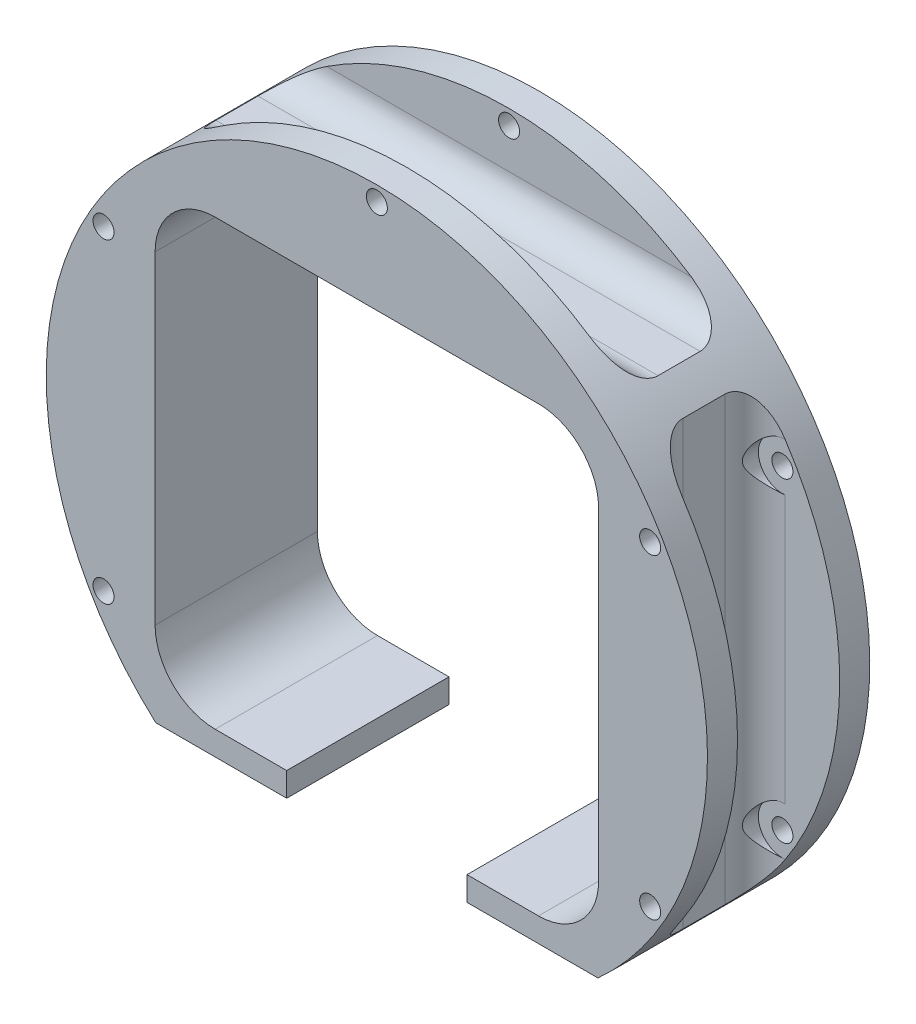
from build123d import *
from build123d.topology import SkipClean

# Parameters (mm, degrees)
SKETCH_2_W               = 77.78174593
SKETCH_2_H               = 77.78174593
SKETCH_2_W_2             = 73.78174593
SKETCH_2_H_2             = 73.78174593
EXTRUDE_1_DEPTH          = 22
SKETCH_3_W               = 30
SKETCH_3_H               = 11.217172917
CUT_EXTRUDE_1_DEPTH      = 25
FILLET_2_R               = 10
EXTRUDE_2_DEPTH          = 5
CUT_EXTRUDE_2_DEPTH      = 120.845734175
CUT_EXTRUDE_2_DEPTH_BACK = 120.845734175
SKETCH_5_R               = 1.5
FILLET_START             = 11.21771439
FILLET_3_DEPTH           = 73.564570859
FILLET_START_2           = -36.78228561
FILLET_3_2_DEPTH         = 73.564570859
FILLET_START_3           = -1e-07
FILLET_3_3_DEPTH         = 22.0000001
EXTRUDE_3_DEPTH          = 5
CUT_EXTRUDE_START        = -5
SKETCH_7_R               = 1.5
CUT_EXTRUDE_3_DEPTH      = 5
FILLET_4_R               = 5
CUT_EXTRUDE_4_DEPTH      = 8.5
CUT_EXTRUDE_4_DEPTH_BACK = 8.5
SKETCH_8_R               = 4
SKETCH_9_R               = 1.75
SKETCH_9_R_2             = 1.5
CUT_EXTRUDE_5_DEPTH      = 120.84573433


with BuildPart() as part:
    # 草图2 → 凸台-拉伸1 (new body)
    # profile 1 of 5: a face of its own
    with BuildSketch(Plane.XY):
        with Locations((0, 48)):
            Rectangle(SKETCH_2_W, SKETCH_2_H)
        with Locations((0, 48)):
            Rectangle(SKETCH_2_W_2, SKETCH_2_H_2, mode=Mode.SUBTRACT)
    # profile 2 of 5: a face of its own
    with BuildSketch(Plane.XY):
        with BuildLine():
            Line((-38.890872965, 9.109127035), (-38.890872965, 86.890872965))
            ThreePointArc((-38.890872965, 86.890872965), (-39.904802737, 85.849791526), (-40.890872965, 84.782285249))
            Line((-40.890872965, 84.782285249), (-40.890872965, 11.217714751))
            ThreePointArc((-40.890872965, 11.217714751), (-39.904802737, 10.150208474), (-38.890872965, 9.109127035))
        make_face()
    # profile 3 of 5: a face of its own
    with BuildSketch(Plane.XY):
        with BuildLine():
            ThreePointArc((-36.782285249, 88.890872965), (-37.849791526, 87.904802737), (-38.890872965, 86.890872965))
            Line((-38.890872965, 86.890872965), (38.890872965, 86.890872965))
            ThreePointArc((38.890872965, 86.890872965), (37.849791526, 87.904802737), (36.782285249, 88.890872965))
            Line((36.782285249, 88.890872965), (-36.782285249, 88.890872965))
        make_face()
    # profile 4 of 5: a face of its own
    with BuildSketch(Plane.XY):
        with BuildLine():
            ThreePointArc((40.890872965, 84.782285249), (39.904802737, 85.849791526), (38.890872965, 86.890872965))
            Line((38.890872965, 86.890872965), (38.890872965, 9.109127035))
            ThreePointArc((38.890872965, 9.109127035), (39.904802737, 10.150208474), (40.890872965, 11.217714751))
            Line((40.890872965, 11.217714751), (40.890872965, 84.782285249))
        make_face()
    # profile 5 of 5: a face of its own
    with BuildSketch(Plane.XY):
        with BuildLine():
            Line((38.890872965, 9.109127035), (-38.890872965, 9.109127035))
            ThreePointArc((-38.890872965, 9.109127035), (-37.849791526, 8.095197263), (-36.782285249, 7.109127035))
            Line((-36.782285249, 7.109127035), (36.782285249, 7.109127035))
            ThreePointArc((36.782285249, 7.109127035), (37.849791526, 8.095197263), (38.890872965, 9.109127035))
        make_face()
    extrude(amount=EXTRUDE_1_DEPTH)

    # 草图3 → 切除-拉伸1 (cut)
    with BuildSketch(Plane.XY.offset(22)):
        with Locations((0, 7.109127035)):
            Rectangle(SKETCH_3_W, SKETCH_3_H)
    extrude(amount=-CUT_EXTRUDE_1_DEPTH, mode=Mode.SUBTRACT)

    # 圆角2
    fillet_2_edges = [part.edges().sort_by_distance(p)[0] for p in [
        (-36.890872965, 11.109127035, 11),
        (36.890872965, 11.109127035, 11),
        (36.890872965, 84.890872965, 11),
        (-36.890872965, 84.890872965, 11),
    ]]
    fillet(fillet_2_edges, radius=FILLET_2_R)

    # 草图4 → 凸台-拉伸2 (add)
    with BuildSketch(Plane.XY.offset(22)):
        with BuildLine():
            Line((32.926987535, 88.890872965), (36.782285249, 88.890872965))
            ThreePointArc((36.782285249, 88.890872965), (0, 103), (-36.782285249, 88.890872965))
            Line((-36.782285249, 88.890872965), (-32.926987535, 88.890872965))
            ThreePointArc((-32.926987535, 88.890872965), (-18.162335251, 97.258294512), (-1.499846931, 100.478571429))
            ThreePointArc((-1.499846931, 100.478571429), (-0.010714559, 101.999961732), (1.5, 100.5))
            ThreePointArc((1.5, 100.5), (1.499961732, 100.489285441), (1.499846931, 100.478571429))
            ThreePointArc((1.499846931, 100.478571429), (18.162335251, 97.258294512), (32.926987535, 88.890872965))
        make_face()
        with BuildLine():
            Line((28.773885871, 88.890872965), (32.926987535, 88.890872965))
            ThreePointArc((32.926987535, 88.890872965), (18.162335251, 97.258294512), (1.499846931, 100.478571429))
            ThreePointArc((1.499846931, 100.478571429), (0, 99), (-1.499846931, 100.478571429))
            ThreePointArc((-1.499846931, 100.478571429), (-18.162335251, 97.258294512), (-32.926987535, 88.890872965))
            Line((-32.926987535, 88.890872965), (-28.773885871, 88.890872965))
            ThreePointArc((-28.773885871, 88.890872965), (0, 98), (28.773885871, 88.890872965))
        make_face()
        with BuildLine():
            Line((40.890872965, 80.926987535), (40.890872965, 84.782285249))
            ThreePointArc((40.890872965, 84.782285249), (38.890872965, 86.890872965), (36.782285249, 88.890872965))
            Line((36.782285249, 88.890872965), (32.926987535, 88.890872965))
            ThreePointArc((32.926987535, 88.890872965), (37.123106012, 85.123106012), (40.890872965, 80.926987535))
        make_face()
        with BuildLine():
            Line((40.890872965, 76.773885871), (40.890872965, 80.926987535))
            ThreePointArc((40.890872965, 80.926987535), (37.123106012, 85.123106012), (32.926987535, 88.890872965))
            Line((32.926987535, 88.890872965), (28.773885871, 88.890872965))
            ThreePointArc((28.773885871, 88.890872965), (35.355339059, 83.355339059), (40.890872965, 76.773885871))
        make_face()
        with BuildLine():
            ThreePointArc((40.890872965, 11.217714751), (51.351718633, 28.302259179), (55, 48))
            ThreePointArc((55, 48), (51.351718633, 67.697740821), (40.890872965, 84.782285249))
            Line((40.890872965, 84.782285249), (40.890872965, 80.926987535))
            ThreePointArc((40.890872965, 80.926987535), (42.879100562, 78.292453433), (44.697852546, 75.538191258))
            ThreePointArc((44.697852546, 75.538191258), (46.207035484, 75.554362244), (46.966333699, 74.25))
            ThreePointArc((46.966333699, 74.25), (46.759981384, 73.490740054), (46.197699477, 72.94038017))
            ThreePointArc((46.197699477, 72.94038017), (50.900045297, 60.862168897), (52.5, 48))
            ThreePointArc((52.5, 48), (50.900045297, 35.137831103), (46.197699477, 23.05961983))
            ThreePointArc((46.197699477, 23.05961983), (46.759981384, 22.509259946), (46.966333699, 21.75))
            ThreePointArc((46.966333699, 21.75), (46.207035484, 20.445637756), (44.697852546, 20.461808742))
            ThreePointArc((44.697852546, 20.461808742), (42.879100562, 17.707546567), (40.890872965, 15.073012465))
            Line((40.890872965, 15.073012465), (40.890872965, 11.217714751))
        make_face()
        with BuildLine():
            ThreePointArc((44.697852546, 75.538191258), (42.879100562, 78.292453433), (40.890872965, 80.926987535))
            Line((40.890872965, 80.926987535), (40.890872965, 76.773885871))
            ThreePointArc((40.890872965, 76.773885871), (47.668352438, 63.09066519), (50, 48))
            ThreePointArc((50, 48), (47.668352438, 32.90933481), (40.890872965, 19.226114129))
            Line((40.890872965, 19.226114129), (40.890872965, 15.073012465))
            ThreePointArc((40.890872965, 15.073012465), (42.879100562, 17.707546567), (44.697852546, 20.461808742))
            ThreePointArc((44.697852546, 20.461808742), (44.167295593, 22.5), (46.197699477, 23.05961983))
            ThreePointArc((46.197699477, 23.05961983), (50.900045297, 35.137831103), (52.5, 48))
            ThreePointArc((52.5, 48), (50.900045297, 60.862168897), (46.197699477, 72.94038017))
            ThreePointArc((46.197699477, 72.94038017), (44.167295593, 73.5), (44.697852546, 75.538191258))
        make_face()
        with BuildLine():
            ThreePointArc((36.782285249, 7.109127035), (38.890872965, 9.109127035), (40.890872965, 11.217714751))
            Line((40.890872965, 11.217714751), (40.890872965, 15.073012465))
            ThreePointArc((40.890872965, 15.073012465), (37.123106012, 10.876893988), (32.926987535, 7.109127035))
            Line((32.926987535, 7.109127035), (36.782285249, 7.109127035))
        make_face()
        with BuildLine():
            ThreePointArc((-36.782285249, 7.109127035), (0, -7), (36.782285249, 7.109127035))
            Line((36.782285249, 7.109127035), (32.926987535, 7.109127035))
            ThreePointArc((32.926987535, 7.109127035), (18.162335251, -1.258294512), (1.499846931, -4.478571429))
            ThreePointArc((1.499846931, -4.478571429), (1.499961732, -4.489285441), (1.5, -4.5))
            ThreePointArc((1.5, -4.5), (-0.010714559, -5.999961732), (-1.499846931, -4.478571429))
            ThreePointArc((-1.499846931, -4.478571429), (-18.162335251, -1.258294512), (-32.926987535, 7.109127035))
            Line((-32.926987535, 7.109127035), (-36.782285249, 7.109127035))
        make_face()
        with BuildLine():
            ThreePointArc((1.499846931, -4.478571429), (18.162335251, -1.258294512), (32.926987535, 7.109127035))
            Line((32.926987535, 7.109127035), (28.773885871, 7.109127035))
            ThreePointArc((28.773885871, 7.109127035), (0, -2), (-28.773885871, 7.109127035))
            Line((-28.773885871, 7.109127035), (-32.926987535, 7.109127035))
            ThreePointArc((-32.926987535, 7.109127035), (-18.162335251, -1.258294512), (-1.499846931, -4.478571429))
            ThreePointArc((-1.499846931, -4.478571429), (0, -3), (1.499846931, -4.478571429))
        make_face()
        with BuildLine():
            ThreePointArc((32.926987535, 7.109127035), (37.123106012, 10.876893988), (40.890872965, 15.073012465))
            Line((40.890872965, 15.073012465), (40.890872965, 19.226114129))
            ThreePointArc((40.890872965, 19.226114129), (35.355339059, 12.644660941), (28.773885871, 7.109127035))
            Line((28.773885871, 7.109127035), (32.926987535, 7.109127035))
        make_face()
        with BuildLine():
            ThreePointArc((-40.890872965, 15.073012465), (-37.123106012, 10.876893988), (-32.926987535, 7.109127035))
            Line((-32.926987535, 7.109127035), (-28.773885871, 7.109127035))
            ThreePointArc((-28.773885871, 7.109127035), (-35.355339059, 12.644660941), (-40.890872965, 19.226114129))
            Line((-40.890872965, 19.226114129), (-40.890872965, 15.073012465))
        make_face()
        with BuildLine():
            ThreePointArc((-40.890872965, 11.217714751), (-38.890872965, 9.109127035), (-36.782285249, 7.109127035))
            Line((-36.782285249, 7.109127035), (-32.926987535, 7.109127035))
            ThreePointArc((-32.926987535, 7.109127035), (-37.123106012, 10.876893988), (-40.890872965, 15.073012465))
            Line((-40.890872965, 15.073012465), (-40.890872965, 11.217714751))
        make_face()
        with BuildLine():
            Line((-40.890872965, 76.773885871), (-40.890872965, 80.926987535))
            ThreePointArc((-40.890872965, 80.926987535), (-42.879100562, 78.292453433), (-44.697852546, 75.538191258))
            ThreePointArc((-44.697852546, 75.538191258), (-44.161971454, 74.990701786), (-43.966333699, 74.25))
            ThreePointArc((-43.966333699, 74.25), (-44.707073752, 72.956352315), (-46.197699477, 72.94038017))
            ThreePointArc((-46.197699477, 72.94038017), (-52.5, 48), (-46.197699477, 23.05961983))
            ThreePointArc((-46.197699477, 23.05961983), (-44.707073752, 23.043647685), (-43.966333699, 21.75))
            ThreePointArc((-43.966333699, 21.75), (-44.161971454, 21.009298214), (-44.697852546, 20.461808742))
            ThreePointArc((-44.697852546, 20.461808742), (-42.879100562, 17.707546567), (-40.890872965, 15.073012465))
            Line((-40.890872965, 15.073012465), (-40.890872965, 19.226114129))
            ThreePointArc((-40.890872965, 19.226114129), (-50, 48), (-40.890872965, 76.773885871))
        make_face()
        with BuildLine():
            Line((-40.890872965, 80.926987535), (-40.890872965, 84.782285249))
            ThreePointArc((-40.890872965, 84.782285249), (-55, 48), (-40.890872965, 11.217714751))
            Line((-40.890872965, 11.217714751), (-40.890872965, 15.073012465))
            ThreePointArc((-40.890872965, 15.073012465), (-42.879100562, 17.707546567), (-44.697852546, 20.461808742))
            ThreePointArc((-44.697852546, 20.461808742), (-46.765371804, 21), (-46.197699477, 23.05961983))
            ThreePointArc((-46.197699477, 23.05961983), (-52.5, 48), (-46.197699477, 72.94038017))
            ThreePointArc((-46.197699477, 72.94038017), (-46.765371804, 75), (-44.697852546, 75.538191258))
            ThreePointArc((-44.697852546, 75.538191258), (-42.879100562, 78.292453433), (-40.890872965, 80.926987535))
        make_face()
        with BuildLine():
            Line((-28.773885871, 88.890872965), (-32.926987535, 88.890872965))
            ThreePointArc((-32.926987535, 88.890872965), (-37.123106012, 85.123106012), (-40.890872965, 80.926987535))
            Line((-40.890872965, 80.926987535), (-40.890872965, 76.773885871))
            ThreePointArc((-40.890872965, 76.773885871), (-35.355339059, 83.355339059), (-28.773885871, 88.890872965))
        make_face()
        with BuildLine():
            Line((-32.926987535, 88.890872965), (-36.782285249, 88.890872965))
            ThreePointArc((-36.782285249, 88.890872965), (-38.890872965, 86.890872965), (-40.890872965, 84.782285249))
            Line((-40.890872965, 84.782285249), (-40.890872965, 80.926987535))
            ThreePointArc((-40.890872965, 80.926987535), (-37.123106012, 85.123106012), (-32.926987535, 88.890872965))
        make_face()
        with BuildLine():
            Line((-40.890872965, 19.226114129), (-40.890872965, 76.773885871))
            ThreePointArc((-40.890872965, 76.773885871), (-50, 48), (-40.890872965, 19.226114129))
        make_face()
        with BuildLine():
            Line((-28.773885871, 88.890872965), (28.773885871, 88.890872965))
            ThreePointArc((28.773885871, 88.890872965), (0, 98), (-28.773885871, 88.890872965))
        make_face()
        with BuildLine():
            Line((40.890872965, 19.226114129), (40.890872965, 76.773885871))
            ThreePointArc((40.890872965, 76.773885871), (35.355339059, 83.355339059), (28.773885871, 88.890872965))
            Line((28.773885871, 88.890872965), (-28.773885871, 88.890872965))
            ThreePointArc((-28.773885871, 88.890872965), (-35.355339059, 83.355339059), (-40.890872965, 76.773885871))
            Line((-40.890872965, 76.773885871), (-40.890872965, 19.226114129))
            ThreePointArc((-40.890872965, 19.226114129), (-35.355339059, 12.644660941), (-28.773885871, 7.109127035))
            Line((-28.773885871, 7.109127035), (-15, 7.109127035))
            Line((-15, 7.109127035), (-15, 11.109127035))
            Line((-15, 11.109127035), (-26.890872965, 11.109127035))
            ThreePointArc((-26.890872965, 11.109127035), (-33.961940777, 14.038059223), (-36.890872965, 21.109127035))
            Line((-36.890872965, 21.109127035), (-36.890872965, 74.890872965))
            ThreePointArc((-36.890872965, 74.890872965), (-33.961940777, 81.961940777), (-26.890872965, 84.890872965))
            Line((-26.890872965, 84.890872965), (26.890872965, 84.890872965))
            ThreePointArc((26.890872965, 84.890872965), (33.961940777, 81.961940777), (36.890872965, 74.890872965))
            Line((36.890872965, 74.890872965), (36.890872965, 21.109127035))
            ThreePointArc((36.890872965, 21.109127035), (33.961940777, 14.038059223), (26.890872965, 11.109127035))
            Line((26.890872965, 11.109127035), (15, 11.109127035))
            Line((15, 11.109127035), (15, 7.109127035))
            Line((15, 7.109127035), (28.773885871, 7.109127035))
            ThreePointArc((28.773885871, 7.109127035), (35.355339059, 12.644660941), (40.890872965, 19.226114129))
        make_face()
        with BuildLine():
            ThreePointArc((50, 48), (47.668352438, 63.09066519), (40.890872965, 76.773885871))
            Line((40.890872965, 76.773885871), (40.890872965, 19.226114129))
            ThreePointArc((40.890872965, 19.226114129), (47.668352438, 32.90933481), (50, 48))
        make_face()
    extrude(amount=EXTRUDE_2_DEPTH)

    # 草图5 → 切除-拉伸2 (cut, two sides: drawn at the far end of the back side and taken through both)
    # profile 1 of 3: a face of its own
    with BuildSketch(Plane.XY.offset(27).offset(-CUT_EXTRUDE_2_DEPTH_BACK)):
        with BuildLine():
            ThreePointArc((36.782285249, 7.109127035), (0, -7), (-36.782285249, 7.109127035))
            Line((-36.782285249, 7.109127035), (-38.920759793, 2.532517826))
            Line((-38.920759793, 2.532517826), (11.125296721, -32.380608099))
            Line((11.125296721, -32.380608099), (36.782285249, 7.109127035))
        make_face()
    # profile 2 of 3: a face of its own
    with BuildSketch(Plane.XY.offset(27).offset(-CUT_EXTRUDE_2_DEPTH_BACK)):
        with BuildLine():
            ThreePointArc((28.773885871, 7.109127035), (0, -2), (-28.773885871, 7.109127035))
            Line((-28.773885871, 7.109127035), (-36.782285249, 7.109127035))
            ThreePointArc((-36.782285249, 7.109127035), (0, -7), (36.782285249, 7.109127035))
            Line((36.782285249, 7.109127035), (28.773885871, 7.109127035))
        make_face()
        with Locations((0, -4.5)):
            Circle(SKETCH_5_R, mode=Mode.SUBTRACT)
    # profile 3 of 3: a face of its own
    with BuildSketch(Plane.XY.offset(27).offset(-CUT_EXTRUDE_2_DEPTH_BACK)):
        with BuildLine():
            Line((-15, 7.109127035), (-28.773885871, 7.109127035))
            ThreePointArc((-28.773885871, 7.109127035), (0, -2), (28.773885871, 7.109127035))
            Line((28.773885871, 7.109127035), (15, 7.109127035))
            Line((15, 7.109127035), (-15, 7.109127035))
        make_face()
    extrude(amount=CUT_EXTRUDE_2_DEPTH + CUT_EXTRUDE_2_DEPTH_BACK, mode=Mode.SUBTRACT)

    # 圆角3: read off the stored shape, not the designer's step
    # 圆角3 outline → 圆角3 (add)
    with BuildSketch(Plane(origin=(0, 0, 0), x_dir=(1, 0, 0), z_dir=(0, 1, 0)).offset(FILLET_START)):
        with BuildLine():
            Line((40.890872965, -22), (45.890872965, -22))
            ThreePointArc((45.890872965, -22), (42.355339059, -20.535533906), (40.890872965, -17))
            Line((40.890872965, -17), (40.890872965, -22))
        make_face()
        with BuildLine():
            ThreePointArc((-40.890872965, -17), (-42.355339059, -20.535533906), (-45.890872965, -22))
            Line((-45.890872965, -22), (-40.890872965, -22))
            Line((-40.890872965, -22), (-40.890872965, -17))
        make_face()
    extrude(amount=FILLET_3_DEPTH)

    # Fillet 3 2 outline → Fillet 3 2 (add)
    with BuildSketch(Plane.YZ.offset(FILLET_START_2)):
        with BuildLine():
            ThreePointArc((88.890872965, 17), (90.355339059, 20.535533906), (93.890872965, 22))
            Line((93.890872965, 22), (88.890872965, 22))
            Line((88.890872965, 22), (88.890872965, 17))
        make_face()
    extrude(amount=FILLET_3_2_DEPTH)

    # Fillet 3 3 outline → Fillet 3 3 (cut)
    with BuildSketch(Plane.XY.offset(FILLET_START_3)):
        with BuildLine():
            ThreePointArc((45.890872965, 17.684529057), (43.511179925, 14.358103182), (40.890872965, 11.217714751))
            Line((40.890872965, 11.217714751), (45.890872965, 11.21771439))
            Line((45.890872965, 11.21771439), (45.890872965, 17.684529057))
        make_face()
        with BuildLine():
            Line((45.890872965, 84.782285249), (40.890872965, 84.782285249))
            ThreePointArc((40.890872965, 84.782285249), (43.511179925, 81.641896818), (45.890872965, 78.315470943))
            Line((45.890872965, 78.315470943), (45.890872965, 84.782285249))
        make_face()
        with BuildLine():
            Line((36.782285249, 93.890872965), (30.315470943, 93.890872965))
            ThreePointArc((30.315470943, 93.890872965), (33.641896818, 91.511179925), (36.782285249, 88.890872965))
            Line((36.782285249, 88.890872965), (36.782285249, 93.890872965))
        make_face()
        with BuildLine():
            Line((-30.315470943, 93.890872965), (-36.78228561, 93.890872965))
            Line((-36.78228561, 93.890872965), (-36.782285249, 88.890872965))
            ThreePointArc((-36.782285249, 88.890872965), (-33.641896818, 91.511179925), (-30.315470943, 93.890872965))
        make_face()
        with BuildLine():
            ThreePointArc((-45.890872965, 78.315470943), (-43.511179925, 81.641896818), (-40.890872965, 84.782285249))
            Line((-40.890872965, 84.782285249), (-45.890872965, 84.782285249))
            Line((-45.890872965, 84.782285249), (-45.890872965, 78.315470943))
        make_face()
        with BuildLine():
            Line((-45.890872965, 17.684529057), (-45.890872965, 11.21771439))
            Line((-45.890872965, 11.21771439), (-40.890872965, 11.217714751))
            ThreePointArc((-40.890872965, 11.217714751), (-43.511179925, 14.358103182), (-45.890872965, 17.684529057))
        make_face()
        with BuildLine():
            ThreePointArc((45.890872965, 23.188668277), (43.966333699, 21.75), (45.890872965, 20.311331723))
            Line((45.890872965, 20.311331723), (45.890872965, 23.188668277))
        make_face()
        with BuildLine():
            Line((45.890872965, 72.811331723), (45.890872965, 75.688668277))
            ThreePointArc((45.890872965, 75.688668277), (43.966333699, 74.25), (45.890872965, 72.811331723))
        make_face()
        with BuildLine():
            Line((-45.890872965, 75.688668277), (-45.890872965, 72.811331723))
            ThreePointArc((-45.890872965, 72.811331723), (-43.966333699, 74.25), (-45.890872965, 75.688668277))
        make_face()
        with BuildLine():
            Line((-45.890872965, 23.188668277), (-45.890872965, 20.311331723))
            ThreePointArc((-45.890872965, 20.311331723), (-43.966333699, 21.75), (-45.890872965, 23.188668277))
        make_face()
    extrude(amount=FILLET_3_3_DEPTH, mode=Mode.SUBTRACT)

    # 草图6 → 凸台-拉伸3 (add)
    with SkipClean():  # the faces are left unmerged after this step: merging them gives an invalid solid
        with BuildSketch(Plane(origin=(0, 0, 0), x_dir=(-1, 0, 0), z_dir=(0, 0, -1))):
            with BuildLine():
                ThreePointArc((-40.890872965, 84.782285249), (-55, 48), (-40.890872965, 11.217714751))
                Line((-40.890872965, 11.217714751), (-40.890872965, 84.782285249))
            make_face()
            with BuildLine():
                ThreePointArc((36.782285249, 88.890872965), (0, 103), (-36.782285249, 88.890872965))
                Line((-36.782285249, 88.890872965), (36.782285249, 88.890872965))
            make_face()
            with BuildLine():
                Line((40.890872965, 84.782285249), (40.890872965, 11.217714751))
                ThreePointArc((40.890872965, 11.217714751), (51.351718633, 28.302259179), (55, 48))
                ThreePointArc((55, 48), (51.351718633, 67.697740821), (40.890872965, 84.782285249))
            make_face()
        extrude(amount=-EXTRUDE_3_DEPTH)

    # 草图7 → 切除-拉伸3 (cut)
    with SkipClean():  # the faces are left unmerged after this step: merging them gives an invalid solid
        with BuildSketch(Plane.XY.offset(5).offset(CUT_EXTRUDE_START)):
            with Locations(Location((45.466333699, 21.75, 0), (0, 0, 286.440899791))):
                Circle(SKETCH_7_R)
            with Locations(Location((45.466333699, 74.25, 0), (0, 0, 286.440899791))):
                Circle(SKETCH_7_R)
            with Locations(Location((-45.466333699, 74.25, 0), (0, 0, 106.440899791))):
                Circle(SKETCH_7_R)
            with Locations(Location((-45.466333699, 21.75, 0), (0, 0, 106.440899791))):
                Circle(SKETCH_7_R)
            with Locations((0, 100.5)):
                Circle(SKETCH_7_R)
        extrude(amount=CUT_EXTRUDE_3_DEPTH, mode=Mode.SUBTRACT)

    # 圆角4
    # the kernel refuses this fillet: 5 mm, written as the material it adds along each edge
    with BuildSketch(Plane(origin=(40.890872965, -1.282285249, 5), x_dir=(0, 0, 1), z_dir=(0, 1, 0))) as fillet_4_piece_1_section:
        with BuildLine():
            CenterArc((FILLET_4_R, FILLET_4_R), FILLET_4_R, 180, 90)
            Line((0, FILLET_4_R), (0, 0))
            Line((0, 0), (FILLET_4_R, 0))
        make_face()
    fillet_4_piece_1 = extrude(amount=98.564570498, mode=Mode.PRIVATE)
    fillet_4_piece_1 = fillet_4_piece_1 & Plane(origin=(0, 48, 5), x_dir=(-0.7434704175501498, -0.6687688227091675, 0), z_dir=(0, 0, -1)) * Cylinder(55, 218, mode=Mode.PRIVATE)
    fillet_4_piece_1 = fillet_4_piece_1 - Plane(origin=(45.466333699, 21.75, 5), x_dir=(0.28302617771549615, -0.9591121846414821, 0), z_dir=(0, 0, -1)) * Cylinder(1.5, 218, mode=Mode.PRIVATE)
    fillet_4_piece_1 = fillet_4_piece_1 - Plane(origin=(45.466333699, 74.25, 5), x_dir=(0.28302617771549615, -0.9591121846414821, 0), z_dir=(0, 0, -1)) * Cylinder(1.5, 218, mode=Mode.PRIVATE)
    add(fillet_4_piece_1)
    with BuildSketch(Plane(origin=(49.282285249, 88.890872965, 5), x_dir=(0, 0, 1), z_dir=(-1, 0, 0))) as fillet_4_piece_2_section:
        with BuildLine():
            CenterArc((FILLET_4_R, FILLET_4_R), FILLET_4_R, 180, 90)
            Line((0, FILLET_4_R), (0, 0))
            Line((0, 0), (FILLET_4_R, 0))
        make_face()
    fillet_4_piece_2 = extrude(amount=98.564570498, mode=Mode.PRIVATE)
    fillet_4_piece_2 = fillet_4_piece_2 & Plane(origin=(0, 48, 5), x_dir=(-0.7434704175501498, -0.6687688227091675, 0), z_dir=(0, 0, -1)) * Cylinder(55, 218, mode=Mode.PRIVATE)
    add(fillet_4_piece_2)
    with BuildSketch(Plane(origin=(-40.890872965, 97.282285249, 5), x_dir=(0, 0, 1), z_dir=(0, -1, 0))) as fillet_4_piece_3_section:
        with BuildLine():
            CenterArc((FILLET_4_R, FILLET_4_R), FILLET_4_R, 180, 90)
            Line((0, FILLET_4_R), (0, 0))
            Line((0, 0), (FILLET_4_R, 0))
        make_face()
    fillet_4_piece_3 = extrude(amount=98.564570498, mode=Mode.PRIVATE)
    fillet_4_piece_3 = fillet_4_piece_3 & Plane(origin=(0, 48, 5), x_dir=(-0.7434704175501498, -0.6687688227091675, 0), z_dir=(0, 0, -1)) * Cylinder(55, 218, mode=Mode.PRIVATE)
    fillet_4_piece_3 = fillet_4_piece_3 - Plane(origin=(-45.466333699, 21.75, 5), x_dir=(-0.2830261777154965, 0.959112184641482, 0), z_dir=(0, 0, -1)) * Cylinder(1.5, 218, mode=Mode.PRIVATE)
    fillet_4_piece_3 = fillet_4_piece_3 - Plane(origin=(-45.466333699, 74.25, 5), x_dir=(-0.2830261777154965, 0.959112184641482, 0), z_dir=(0, 0, -1)) * Cylinder(1.5, 218, mode=Mode.PRIVATE)
    add(fillet_4_piece_3)

    # 草图8 → 切除-拉伸4 (cut, two sides: drawn at the far end of the back side and taken through both)
    with BuildSketch(Plane(origin=(0, 0, 13.5), x_dir=(-1, 0, 0), z_dir=(0, 0, -1)).offset(-CUT_EXTRUDE_4_DEPTH_BACK)):
        with Locations((-45.466333699, 74.25)):
            Circle(SKETCH_8_R)
        with Locations((-45.466333699, 21.75)):
            Circle(SKETCH_8_R)
        with Locations((45.466333699, 21.75)):
            Circle(SKETCH_8_R)
        with Locations((45.466333699, 74.25)):
            Circle(SKETCH_8_R)
    extrude(amount=CUT_EXTRUDE_4_DEPTH + CUT_EXTRUDE_4_DEPTH_BACK, mode=Mode.SUBTRACT)

    # 草图9 → 切除-拉伸5 (cut, through all)
    # profile 1 of 5: a face of its own
    with BuildSketch(Plane(origin=(0, 0, 0), x_dir=(-1, 0, 0), z_dir=(0, 0, -1))):
        with Locations((-45.466333699, 74.25)):
            Circle(SKETCH_9_R)
        with Locations((-45.466333699, 74.25)):
            Circle(SKETCH_9_R_2, mode=Mode.SUBTRACT)
    # profile 2 of 5: a face of its own
    with BuildSketch(Plane(origin=(0, 0, 0), x_dir=(-1, 0, 0), z_dir=(0, 0, -1))):
        with Locations((0, 100.5)):
            Circle(SKETCH_9_R)
        with Locations((0, 100.5)):
            Circle(SKETCH_9_R_2, mode=Mode.SUBTRACT)
    # profile 3 of 5: a face of its own
    with BuildSketch(Plane(origin=(0, 0, 0), x_dir=(-1, 0, 0), z_dir=(0, 0, -1))):
        with Locations((45.466333699, 74.25)):
            Circle(SKETCH_9_R)
        with Locations((45.466333699, 74.25)):
            Circle(SKETCH_9_R_2, mode=Mode.SUBTRACT)
    # profile 4 of 5: a face of its own
    with BuildSketch(Plane(origin=(0, 0, 0), x_dir=(-1, 0, 0), z_dir=(0, 0, -1))):
        with Locations((45.466333699, 21.75)):
            Circle(SKETCH_9_R)
        with Locations((45.466333699, 21.75)):
            Circle(SKETCH_9_R_2, mode=Mode.SUBTRACT)
    # profile 5 of 5: a face of its own
    with BuildSketch(Plane(origin=(0, 0, 0), x_dir=(-1, 0, 0), z_dir=(0, 0, -1))):
        with Locations((-45.466333699, 21.75)):
            Circle(SKETCH_9_R)
        with Locations((-45.466333699, 21.75)):
            Circle(SKETCH_9_R_2, mode=Mode.SUBTRACT)
    extrude(amount=-CUT_EXTRUDE_5_DEPTH, mode=Mode.SUBTRACT)


solid = part.part
